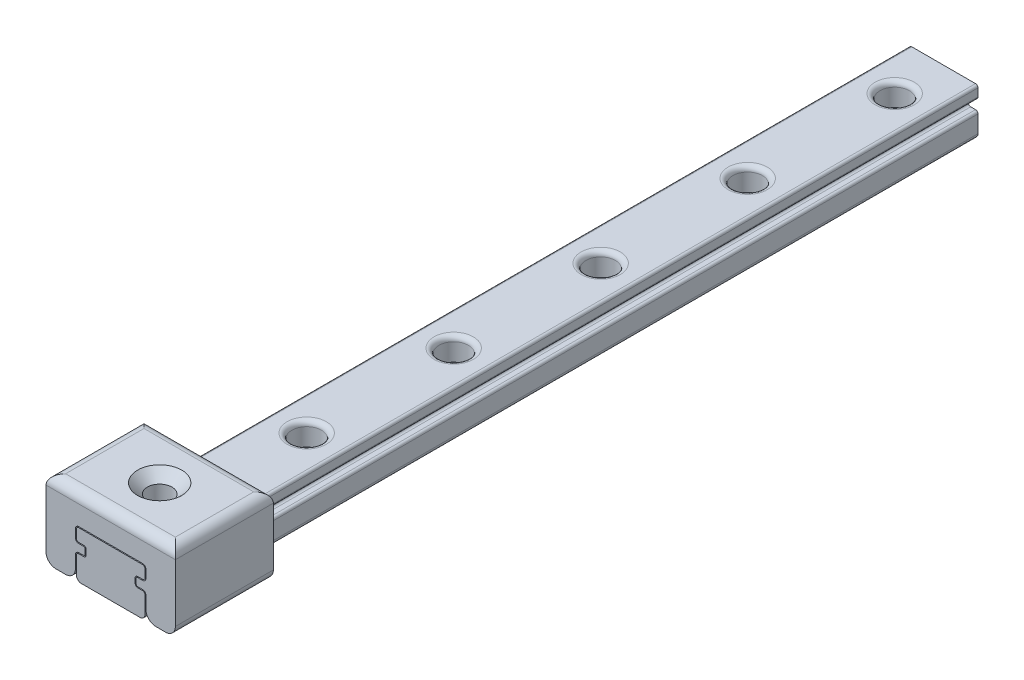
from build123d import *

# Parameters (mm, degrees)
EXTRUDE_1_DEPTH                = 150
FILLET_1_R                     = 0.25
FILLET_2_R                     = 0.5
SKETCH_2_R                     = 1.5
CUT_EXTRUDE_1_DEPTH            = 2.3
SKETCH_3_R                     = 1.2
CUT_EXTRUDE_2_DEPTH            = 151.184053747
FILLET_3_R                     = 0.5
PATTERN_LINEAR_2_COUNT         = 10
PATTERN_LINEAR_2_PITCH         = 15
FILLET_3_OF_PATTERN_LINEAR_2_R = 0.5
SKETCH_4_W                     = 7.607362056
SKETCH_4_H                     = 5.534224128
CUT_EXTRUDE_3_DEPTH            = 65
EXTRUDE_START                  = -85
EXTRUDE_2_DEPTH                = 10
FILLET_4_R                     = 1
MM_START                       = 4.9
MM_1_OUTLINE_R                 = 1.25
MM_1_DEPTH                     = 3
CHAMFER_1_SIZE                 = 1


# Read off the part's stored shape, not the designer's step: 大小mm 暗销孔1
with BuildPart() as part:
    # 草图1 → 凸台-拉伸1 (new body)
    with BuildSketch(Plane.XY):
        Polygon((7, 2.5), (7, 0), (0, 0), (0, 2.5), (1, 2.5), (1, 3.5), (0, 3.5), (0, 4.8), (7, 4.8), (7, 3.5), (6, 3.5), (6, 2.5), align=None)
    extrude(amount=EXTRUDE_1_DEPTH)

    # 圆角1
    fillet_1_edges = [part.edges().sort_by_distance(p)[0] for p in [
        (0, 2.5, 75),
        (1, 2.5, 75),
        (1, 3.5, 75),
        (0, 3.5, 75),
        (0, 4.8, 75),
        (7, 4.8, 75),
        (7, 3.5, 75),
        (6, 3.5, 75),
        (6, 2.5, 75),
        (7, 2.5, 75),
    ]]
    fillet(fillet_1_edges, radius=FILLET_1_R)

    # 圆角2
    fillet_2_edges = [part.edges().sort_by_distance(p)[0] for p in [
        (7, 0, 75),
        (0, 0, 75),
    ]]
    fillet(fillet_2_edges, radius=FILLET_2_R)

    # 草图2 → 切除-拉伸1 (cut)
    with BuildSketch(Plane(origin=(0, 4.8, 0), x_dir=(1, 0, 0), z_dir=(0, 1, 0))):
        with Locations(Location((3.5, -5, 0), (0, 0, 270))):
            Circle(SKETCH_2_R)
    cut_extrude_1 = extrude(amount=-CUT_EXTRUDE_1_DEPTH, mode=Mode.SUBTRACT)

    # 草图3 → 切除-拉伸2 (cut, through all)
    with BuildSketch(Plane(origin=(0, 2.5, 0), x_dir=(1, 0, 0), z_dir=(0, 1, 0))):
        with Locations(Location((3.5, -5, 0), (0, 0, 270))):
            Circle(SKETCH_3_R)
    cut_extrude_2 = extrude(amount=-CUT_EXTRUDE_2_DEPTH, mode=Mode.SUBTRACT)

    # 圆角3
    fillet_3_edges = [part.edges().sort_by_distance(p)[0] for p in [
        (3.5, 4.8, 3.5),
    ]]
    fillet(fillet_3_edges, radius=FILLET_3_R)

    # 阵列(线性)2: 切除-拉伸1, 切除-拉伸2 ×10
    with Locations(*[(0, 0, i * PATTERN_LINEAR_2_PITCH) for i in range(1, PATTERN_LINEAR_2_COUNT)]):
        add(cut_extrude_1, mode=Mode.SUBTRACT)
        add(cut_extrude_2, mode=Mode.SUBTRACT)

    # 圆角3 of 阵列(线性)2
    fillet_3_of_pattern_linear_2_edges = [part.edges().sort_by_distance(p)[0] for p in [
        (3.5, 4.8, 18.5),
        (3.5, 4.8, 33.5),
        (3.5, 4.8, 48.5),
        (3.5, 4.8, 63.5),
        (3.5, 4.8, 78.5),
        (3.5, 4.8, 93.5),
        (3.5, 4.8, 108.5),
        (3.5, 4.8, 123.5),
        (3.5, 4.8, 138.5),
    ]]
    fillet(fillet_3_of_pattern_linear_2_edges, radius=FILLET_3_OF_PATTERN_LINEAR_2_R)

    # 草图4 → 切除-拉伸3 (cut)
    with BuildSketch(Plane.XY.offset(150)):
        with Locations((3.651776821, 2.327683724)):
            Rectangle(SKETCH_4_W, SKETCH_4_H)
    extrude(amount=-CUT_EXTRUDE_3_DEPTH, mode=Mode.SUBTRACT)


with BuildPart() as body_2:
    # 草图5 → 凸台-拉伸2 (new body)
    with BuildSketch(Plane(origin=(0, 0, 0), x_dir=(-1, 0, 0), z_dir=(0, 0, -1)).offset(EXTRUDE_START)):
        with BuildLine():
            ThreePointArc((0.1, 4.55), (-0.002512627, 4.797487373), (-0.25, 4.9))
            Line((-0.25, 4.9), (-6.75, 4.9))
            ThreePointArc((-6.75, 4.9), (-6.997487373, 4.797487373), (-7.1, 4.55))
            Line((-7.1, 4.55), (-7.1, 3.75))
            ThreePointArc((-7.1, 3.75), (-6.997487373, 3.502512627), (-6.75, 3.4))
            Line((-6.75, 3.4), (-6.25, 3.4))
            ThreePointArc((-6.25, 3.4), (-6.143933983, 3.356066017), (-6.1, 3.25))
            Line((-6.1, 3.25), (-6.1, 2.75))
            ThreePointArc((-6.1, 2.75), (-6.143933983, 2.643933983), (-6.25, 2.6))
            Line((-6.25, 2.6), (-6.75, 2.6))
            ThreePointArc((-6.75, 2.6), (-6.997487373, 2.497487373), (-7.1, 2.25))
            Line((-7.1, 2.25), (-7.1, 0))
            Line((-7.1, 0), (-10.1, 0))
            Line((-10.1, 0), (-10.1, 7.9))
            Line((-10.1, 7.9), (3.1, 7.9))
            Line((3.1, 7.9), (3.1, 0))
            Line((3.1, 0), (0.1, 0))
            Line((0.1, 0), (0.1, 2.25))
            ThreePointArc((0.1, 2.25), (-0.002512627, 2.497487373), (-0.25, 2.6))
            Line((-0.25, 2.6), (-0.75, 2.6))
            ThreePointArc((-0.75, 2.6), (-0.856066017, 2.643933983), (-0.9, 2.75))
            Line((-0.9, 2.75), (-0.9, 3.25))
            ThreePointArc((-0.9, 3.25), (-0.856066017, 3.356066017), (-0.75, 3.4))
            Line((-0.75, 3.4), (-0.25, 3.4))
            ThreePointArc((-0.25, 3.4), (-0.002512627, 3.502512627), (0.1, 3.75))
            Line((0.1, 3.75), (0.1, 4.55))
        make_face()
    extrude(amount=EXTRUDE_2_DEPTH)

    # 圆角4
    fillet_4_edges = [body_2.edges().sort_by_distance(p)[0] for p in [
        (3.5, 7.9, 85),
        (3.5, 7.9, 75),
        (-0.1, 0, 80),
        (-3.1, 0, 80),
        (-3.1, 7.9, 80),
        (10.1, 7.9, 80),
        (10.1, 0, 80),
        (7.1, 0, 80),
    ]]
    fillet(fillet_4_edges, radius=FILLET_4_R)

    # 大小mm 暗销孔1 outline → 大小mm 暗销孔1 (cut)
    with BuildSketch(Plane(origin=(0, 0, 0), x_dir=(1, 0, 0), z_dir=(0, 1, 0)).offset(MM_START)):
        with Locations((3.5, -80)):
            Circle(MM_1_OUTLINE_R)
    extrude(amount=MM_1_DEPTH, mode=Mode.SUBTRACT)

    # 倒角1
    chamfer_1_edges = [body_2.edges().sort_by_distance(p)[0] for p in [
        (2.25, 7.9, 80),
    ]]
    chamfer(chamfer_1_edges, length=CHAMFER_1_SIZE)


solid = Compound([part.part, body_2.part])
